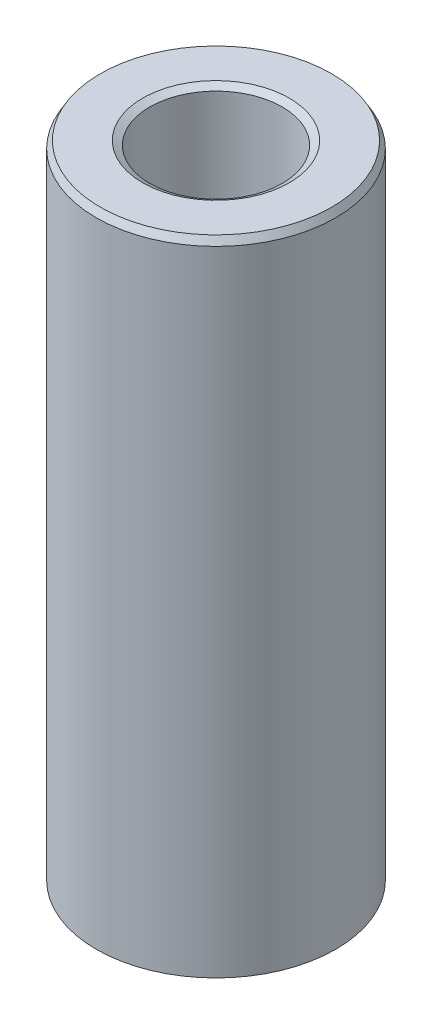
from build123d import *
from OCP.BRepFilletAPI import BRepFilletAPI_MakeChamfer

# Parameters (mm, degrees)
SKETCH1_R           = 52.5
BOSS_EXTRUDE1_DEPTH = 282.609990496
SKETCH2_R           = 29.041877815
CUT_EXTRUDE1_DEPTH  = 293.200114182
CHAMFER1_SIZE       = 3.104408787
CHAMFER1_SIZE2      = 1.792331249


with BuildPart() as part:
    # Sketch1 → Boss-Extrude1 (new body)
    with BuildSketch(Plane(origin=(0, 0, 0), x_dir=(1, 0, 0), z_dir=(0, 1, 0))):
        Circle(SKETCH1_R)
    extrude(amount=BOSS_EXTRUDE1_DEPTH)

    # Sketch2 → Cut-Extrude1 (cut, through all)
    with BuildSketch(Plane(origin=(0, 0, 0), x_dir=(1, 0, 0), z_dir=(0, 1, 0))):
        Circle(SKETCH2_R)
    extrude(amount=CUT_EXTRUDE1_DEPTH, mode=Mode.SUBTRACT)

    # Chamfer1: one chamfer whose edges measure the first distance from different faces: ONE call of the kernel's chamfer builder (chamfer() names one face for all edges)
    chamfer1_edges_1 = [part.edges().sort_by_distance(p)[0] for p in [
        (-29.041877815, 282.609990496, 0),
    ]]
    chamfer1_side_1 = [part.faces().sort_by_distance(p)[0] for p in [
        (-51.01507576, 282.609990496, 0),
    ]]
    chamfer1_edges_2 = [part.edges().sort_by_distance(p)[0] for p in [
        (-29.041877815, 0, 0),
    ]]
    chamfer1_side_2 = [part.faces().sort_by_distance(p)[0] for p in [
        (-29.041877815, 141.304995248, 0),
    ]]
    chamfer1_edges_3 = [part.edges().sort_by_distance(p)[0] for p in [
        (-52.5, 0, 0),
    ]]
    chamfer1_side_3 = [part.faces().sort_by_distance(p)[0] for p in [
        (-51.01507576, 0, 0),
    ]]
    chamfer1_edges_4 = [part.edges().sort_by_distance(p)[0] for p in [
        (-52.5, 282.609990496, 0),
    ]]
    chamfer1_side_4 = [part.faces().sort_by_distance(p)[0] for p in [
        (-52.5, 141.304995248, 0),
    ]]
    chamfer1 = BRepFilletAPI_MakeChamfer(part.part.solid().wrapped)
    for e in chamfer1_edges_1:
        chamfer1.Add(CHAMFER1_SIZE, CHAMFER1_SIZE2, e.wrapped, chamfer1_side_1[0].wrapped)  # the first distance lies on this face
    for e in chamfer1_edges_2:
        chamfer1.Add(CHAMFER1_SIZE, CHAMFER1_SIZE2, e.wrapped, chamfer1_side_2[0].wrapped)  # the first distance lies on this face
    for e in chamfer1_edges_3:
        chamfer1.Add(CHAMFER1_SIZE, CHAMFER1_SIZE2, e.wrapped, chamfer1_side_3[0].wrapped)  # the first distance lies on this face
    for e in chamfer1_edges_4:
        chamfer1.Add(CHAMFER1_SIZE, CHAMFER1_SIZE2, e.wrapped, chamfer1_side_4[0].wrapped)  # the first distance lies on this face
    add(Compound.cast(chamfer1.Shape()), mode=Mode.REPLACE)


solid = part.part
